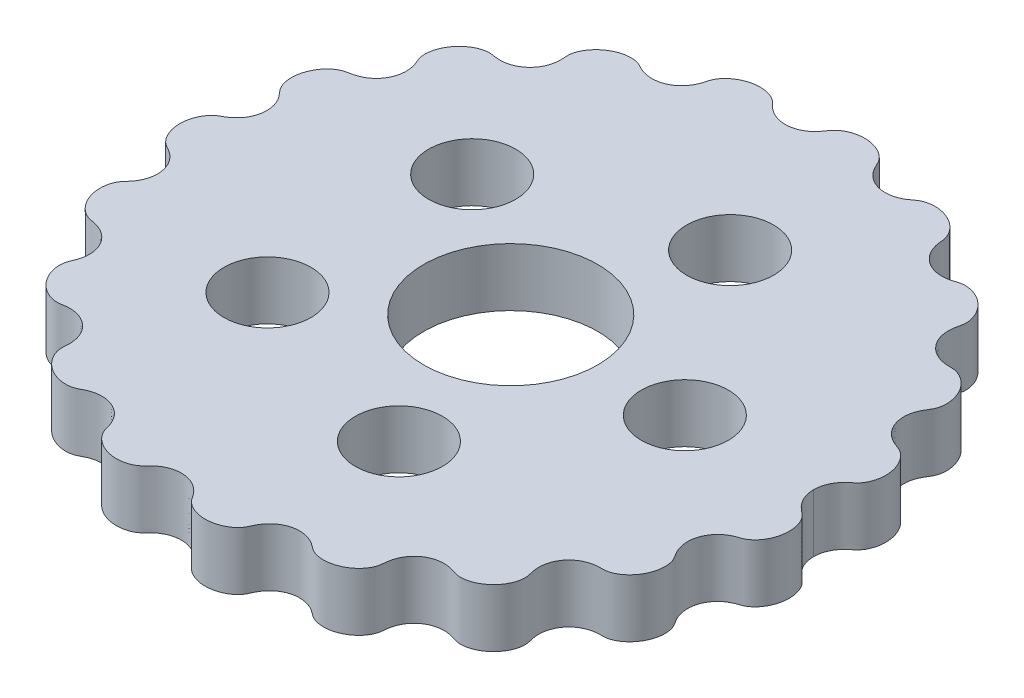
from build123d import *

# Parameters (mm, degrees)
BOSS_EXTRUDE1_START = 0.5
SKETCH1_R           = 7.5
SKETCH1_R_2         = 3.75
BOSS_EXTRUDE1_DEPTH = 5


with BuildPart() as part:
    # Sketch1 → Boss-Extrude1 (new body)
    with BuildSketch(Plane(origin=(0, 0, 0), x_dir=(1, 0, 0), z_dir=(0, 1, 0)).offset(BOSS_EXTRUDE1_START)):
        with BuildLine():
            add(Edge.make_bspline(
                [(26.100000001, 0), (26.100000001, -0.037654823), (26.101959838, -0.112657778), (26.110778914, -0.269126865), (26.134236474, -0.431457932), (26.169271902, -0.604227737), (26.215706935, -0.771665888), (26.2732951, -0.936077152), (26.341753555, -1.096140667), (26.427915849, -1.265624131), (26.534785055, -1.441856171), (26.699683699, -1.67031679), (26.901439537, -1.88987584), (27.124804262, -2.086960491), (27.362808408, -2.265185488), (27.541686596, -2.422902757), (27.696832367, -2.612532966), (27.831038284, -2.823925745), (27.942707414, -3.055157968), (28.032027129, -3.302051278), (28.11328707, -3.620150325), (28.164200717, -4.011385863), (28.158229712, -4.465911271), (28.068723695, -4.971978987), (27.92239684, -5.391891507), (27.752179238, -5.726439419), (27.579155333, -5.986088777), (27.422588116, -6.181127718), (27.208663225, -6.396612626), (26.970426874, -6.581500429), (26.704262294, -6.714420074), (26.426139512, -6.802056051), (26.208386955, -6.88526241), (25.996005014, -6.981754411), (25.792352168, -7.095680473), (25.506454674, -7.288419365), (25.166810016, -7.595932091), (24.823327667, -8.065640834), (24.573113299, -8.72284226), (24.513192387, -9.374110704), (24.595878356, -9.908866564), (24.732910005, -10.306165942), (24.863450157, -10.578322252), (24.983619743, -10.787813544), (25.118076956, -10.987994036), (25.243899655, -11.194436481), (25.335973849, -11.425133948), (25.399465388, -11.670686177), (25.434320143, -11.928228008), (25.441972483, -12.193681648), (25.418791023, -12.524941115), (25.342360013, -12.916594687), (25.191232071, -13.347764303), (24.944934542, -13.798710217), (24.636097611, -14.197365909), (24.319379046, -14.49299579), (24.014552178, -14.704170688), (23.744181638, -14.844097629), (23.521984724, -14.930759504), (23.295178334, -14.990896749), (23.066212193, -15.018050457), (22.836177534, -15.015427607), (22.60645362, -15.01876633), (22.377139997, -15.037432831), (22.149964766, -15.073477643), (21.901722715, -15.134262004), (21.63640528, -15.227464361), (21.285248205, -15.397408544), (20.867012031, -15.696199645), (20.457707614, -16.15442787), (20.167634198, -16.744097483), (20.040652676, -17.344074218), (20.044251146, -17.837567352), (20.101291606, -18.208300972), (20.178290253, -18.510160997), (20.237387066, -18.752911084), (20.254165851, -19.007094175), (20.236737197, -19.264546648), (20.175345509, -19.587685891), (20.045401481, -19.966212229), (19.825733649, -20.379092954), (19.503349148, -20.792215121), (19.125691798, -21.140607349), (18.706122195, -21.419205006), (18.312603135, -21.597813456), (17.95729147, -21.7007495), (17.659059083, -21.747208145), (17.425046357, -21.759337106), (17.196962801, -21.74598206), (16.978070969, -21.704489959), (16.767542661, -21.633081261), (16.557577444, -21.561231407), (16.343192492, -21.502693833), (16.125264662, -21.459296016), (15.796467785, -21.420434357), (15.354937396, -21.427964236), (14.788969176, -21.550301969), (14.15455542, -21.88057341), (13.666183716, -22.345893253), (13.336362649, -22.88226304), (13.173492136, -23.353715627), (13.104616128, -23.716957195), (13.076673275, -24.02279806), (13.057814189, -24.268242303), (12.998712206, -24.514111874), (12.903235055, -24.754151925), (12.744151813, -25.045309117), (12.499019901, -25.369043134), (12.15565715, -25.696338346), (11.704870213, -25.994619846), (11.211604108, -26.212225806), (10.68997676, -26.343697667), (10.221282682, -26.37756552), (9.820613034, -26.342575186), (9.498973158, -26.26665957), (9.255580912, -26.177092448), (9.029799659, -26.05655854), (8.831572762, -25.902571784), (8.58391576, -25.71111477), (8.264466121, -25.51104552), (7.810081456, -25.312340621), (7.205513819, -25.192791232), (6.550224923, -25.228730885), (5.971337018, -25.424349477), (5.536862389, -25.687803773), (5.245653307, -25.938729612), (5.05538626, -26.143844122), (4.899938262, -26.348212338), (4.774598738, -26.545523005), (4.66455004, -26.751857795), (4.569043476, -26.964881996), (4.476314366, -27.179586841), (4.353499791, -27.379281189), (4.203299856, -27.561863118), (4.032131291, -27.727950003), (3.79525899, -27.914521158), (3.482483914, -28.102825699), (3.089596665, -28.268830385), (2.604961188, -28.388334129), (2.095437226, -28.431200093), (1.573536083, -28.390048007), (1.119470453, -28.272805038), (0.751616161, -28.112409401), (0.4727867, -27.939857046), (0.273494126, -27.780889901), (0.100220004, -27.601224467), (-0.036900457, -27.400701128), (-0.167623208, -27.196704665), (-0.313051844, -27.002366981), (-0.512485215, -26.773835259), (-0.825221581, -26.489940267), (-1.286824513, -26.202366803), (-1.90652456, -26.003420899), (-2.599411552, -25.975353149), (-3.156761696, -26.100953574), (-3.565273796, -26.283242121), (-3.853430429, -26.463789354), (-4.040862241, -26.604608953), (-4.216144571, -26.760241463), (-4.380398314, -26.92724911), (-4.535647831, -27.102695562), (-4.7080389, -27.262129389), (-4.906562373, -27.395532872), (-5.122340191, -27.506639083), (-5.353111081, -27.594765527), (-5.595122062, -27.660809079), (-5.904112164, -27.714960075), (-6.280362612, -27.736643211), (-6.724192807, -27.701413515), (-7.222479814, -27.579956195), (-7.639241178, -27.403463388), (-7.974539319, -27.20159547), (-8.231562236, -27.001455404), (-8.420763279, -26.822438839), (-8.588375146, -26.628010193), (-8.729951421, -26.419225267), (-8.843841455, -26.197883212), (-8.918149441, -25.965106023), (-8.973095057, -25.727696563), (-9.043925473, -25.494305036), (-9.153099618, -25.209622768), (-9.306801805, -24.915867583), (-9.513499075, -24.623747571), (-9.839816184, -24.284860522), (-10.264400599, -23.977825959), (-10.829665695, -23.73805203), (-11.410498796, -23.660908882), (-11.876291721, -23.69638221), (-12.218754959, -23.773476834), (-12.444677349, -23.84513133), (-12.663781479, -23.935334112), (-12.876076728, -24.040286172), (-13.082031425, -24.157155246), (-13.298581127, -24.254322867), (-13.533913594, -24.317810826), (-13.780466914, -24.35378875), (-14.035834908, -24.361637388), (-14.296405869, -24.343065665), (-14.618522572, -24.288656576), (-14.994949776, -24.177456101), (-15.408578969, -23.98833338), (-15.837205257, -23.700628449), (-16.16490731, -23.393911293), (-16.404344734, -23.097848292), (-16.573318675, -22.829755719), (-16.687662049, -22.603571121), (-16.776686852, -22.372337621), (-16.837746076, -22.138542446), (-16.870186158, -21.9045043), (-16.866368416, -21.674536104), (-16.843233105, -21.446228653), (-16.832615307, -21.216921003), (-16.837266827, -20.987328792), (-16.860312682, -20.758768834), (-16.923293404, -20.419212422), (-17.071833991, -19.980587652), (-17.369040524, -19.477210915), (-17.874882375, -18.988476541), (-18.447970132, -18.67719025), (-19.027548133, -18.525710765), (-19.510111737, -18.503831617), (-19.876648139, -18.538267665), (-20.177623885, -18.593432706), (-20.42137194, -18.622411671), (-20.671244853, -18.609095567), (-20.920859774, -18.564988583), (-21.167935078, -18.490627654), (-21.4095885, -18.389962143), (-21.698210119, -18.235368531), (-22.02014446, -18.009296139), (-22.350982926, -17.698329853), (-22.663749807, -17.29065213), (-22.904833826, -16.843369276), (-23.047778376, -16.427343965), (-23.116267898, -16.057121475), (-23.13204139, -15.75076918), (-23.118687314, -15.513701439), (-23.079662445, -15.285779121), (-23.010740762, -15.071995011), (-22.917965638, -14.867945737), (-22.831783511, -14.661241535), (-22.759010837, -14.449176582), (-22.702274861, -14.232285466), (-22.657962991, -13.982307736), (-22.635886805, -13.699380389), (-22.650675118, -13.300053937), (-22.761871082, -12.783822482), (-23.029318636, -12.21492364), (-23.467562019, -11.712001704), (-23.923403017, -11.398122255), (-24.315464063, -11.222988994), (-24.609412241, -11.131419108), (-24.849484665, -11.076013531), (-25.092573068, -11.038656205), (-25.334505587, -10.990769991), (-25.569274268, -10.900544213), (-25.793687583, -10.779741828), (-26.005954771, -10.630692764), (-26.204437625, -10.457777096), (-26.430332209, -10.218351564), (-26.664824108, -9.899800806), (-26.878975385, -9.499593675), (-27.044436205, -9.01574461), (-27.129961923, -8.520121003), (-27.134474175, -8.0871314), (-27.084857153, -7.719810764), (-27.006013082, -7.425910719), (-26.920443462, -7.203342298), (-26.812236106, -6.99521479), (-26.678616217, -6.807274427), (-26.521312284, -6.639361313), (-26.367637466, -6.468593342), (-26.225484225, -6.287683037), (-26.097389186, -6.096643611), (-25.974680444, -5.876177314), (-25.864713462, -5.624531597), (-25.752433681, -5.264729725), (-25.681810261, -4.762581394), (-25.73099742, -4.146949182), (-25.961949285, -3.524047609), (-26.321265325, -3.010597952), (-26.690239717, -2.672986455), (-27.000992367, -2.462677557), (-27.274877294, -2.314024503), (-27.49416336, -2.194208061), (-27.693761752, -2.035785351), (-27.872384261, -1.849426066), (-28.029881682, -1.639477669), (-28.165833208, -1.41056993), (-28.278417606, -1.169112764), (-28.356850628, -0.949924532), (-28.409926509, -0.757383066), (-28.444786226, -0.594531067), (-28.467072671, -0.464613598), (-28.483773852, -0.334062838), (-28.494901549, -0.194206271), (-28.499073007, -0.086237954), (-28.499999999, -0.028769446), (-28.499999999, 0)],
                knots=[0.065357727, 0.065357727, 0.065357727, 0.065357727, 0.065357727, 0.066838802, 0.068319877, 0.069800952, 0.071282027, 0.072763102, 0.074244177, 0.075725252, 0.077206327, 0.079230954, 0.081255581, 0.085304836, 0.087329463, 0.08935409, 0.091378717, 0.093403344, 0.095635344, 0.097867345, 0.100099346, 0.102331347, 0.106795348, 0.11125935, 0.115505731, 0.119752112, 0.121875303, 0.123998494, 0.126121685, 0.128244875, 0.132212277, 0.134195978, 0.136179679, 0.13816338, 0.140147081, 0.142130782, 0.144114483, 0.149889299, 0.155664115, 0.161716618, 0.167769121, 0.171875721, 0.17392902, 0.17598232, 0.17803562, 0.18008892, 0.182142219, 0.184195519, 0.186452911, 0.188710303, 0.190967695, 0.193225087, 0.197739871, 0.202254655, 0.206449673, 0.210644692, 0.21483971, 0.216937219, 0.219034728, 0.220990732, 0.222946736, 0.22490274, 0.226858744, 0.228814748, 0.230770752, 0.232726756, 0.23468276, 0.237505487, 0.240328214, 0.245973668, 0.25207373, 0.258173791, 0.262418319, 0.266662848, 0.268785112, 0.270907376, 0.27302964, 0.275151904, 0.277414155, 0.279676405, 0.284200907, 0.288725408, 0.29324991, 0.297434601, 0.301619291, 0.305803982, 0.307896327, 0.309988673, 0.311878349, 0.313768025, 0.315657701, 0.317547377, 0.319437053, 0.32132673, 0.323216406, 0.325106082, 0.330697764, 0.336289446, 0.3427217, 0.349153953, 0.353337838, 0.357521724, 0.359613666, 0.361705609, 0.363797552, 0.365889495, 0.368183967, 0.37047844, 0.375067386, 0.379656332, 0.384245278, 0.388791482, 0.393337686, 0.39788389, 0.400156991, 0.402430093, 0.404562559, 0.406695025, 0.408827491, 0.410959957, 0.415224889, 0.419489821, 0.425619329, 0.431748836, 0.43728204, 0.440048642, 0.442815244, 0.444803142, 0.446791041, 0.44877894, 0.450766838, 0.452754737, 0.454742636, 0.456730534, 0.458718433, 0.460783687, 0.462848941, 0.466979449, 0.471109956, 0.475240464, 0.479777245, 0.484314026, 0.488850807, 0.491119197, 0.493387587, 0.495450918, 0.497514249, 0.499577579, 0.50164091, 0.503704241, 0.505767572, 0.509894233, 0.515977148, 0.522060063, 0.527644163, 0.533228263, 0.535221378, 0.537214493, 0.539207608, 0.541200724, 0.543193839, 0.545186954, 0.54718007, 0.549173185, 0.551305995, 0.553438805, 0.555571614, 0.557704424, 0.561970044, 0.566235664, 0.570664673, 0.575093682, 0.577308187, 0.579522691, 0.581737196, 0.583951701, 0.586025843, 0.588099985, 0.590174127, 0.592248269, 0.594322411, 0.596396553, 0.600544837, 0.603500405, 0.606455973, 0.612367108, 0.61826056, 0.624154012, 0.626168793, 0.628183573, 0.630198354, 0.632213134, 0.634227915, 0.636242695, 0.638257476, 0.640272256, 0.642493095, 0.644713933, 0.646934771, 0.64915561, 0.653597287, 0.658038963, 0.662348161, 0.666657359, 0.668811958, 0.670966557, 0.673121156, 0.675275756, 0.677228627, 0.679181499, 0.681134371, 0.683087243, 0.685040114, 0.686992986, 0.688945858, 0.69089873, 0.696785964, 0.702673198, 0.708614477, 0.714555757, 0.718723943, 0.722892129, 0.724976222, 0.727060315, 0.729144408, 0.7312285, 0.733454223, 0.735679945, 0.737905667, 0.740131389, 0.744582833, 0.749034278, 0.753292913, 0.757551548, 0.761810184, 0.763939501, 0.766068819, 0.767975191, 0.769881564, 0.771787936, 0.773694308, 0.77560068, 0.777507052, 0.779413425, 0.781319797, 0.784235185, 0.787150573, 0.792981348, 0.799176944, 0.80537254, 0.809561259, 0.811655619, 0.813749979, 0.815844338, 0.817938698, 0.820033058, 0.822127418, 0.82436519, 0.826602962, 0.828840734, 0.831078507, 0.835554051, 0.840029596, 0.844222519, 0.848415442, 0.852608365, 0.854704826, 0.856801288, 0.858757317, 0.860713346, 0.862669375, 0.864625404, 0.866581433, 0.868537462, 0.870493491, 0.872449521, 0.875160805, 0.87787209, 0.883294658, 0.889615361, 0.895936064, 0.900181909, 0.904427753, 0.906550675, 0.908673598, 0.91079652, 0.912919442, 0.915182616, 0.91744579, 0.919708964, 0.921972138, 0.924235312, 0.925366899, 0.926498486, 0.927630073, 0.92876166, 0.929893247, 0.931024834, 0.931024834, 0.931024834, 0.931024834, 0.931024834], degree=4))
            add(Edge.make_bspline(
                [(26.100000001, 0), (26.100000001, 0.037557605), (26.101960172, 0.11236891), (26.11078076, 0.268515148), (26.134241319, 0.430312774), (26.169279567, 0.602699325), (26.215712536, 0.769655848), (26.273296838, 0.933610033), (26.34172375, 1.093214643), (26.427887255, 1.262171064), (26.534631095, 1.437956629), (26.66472128, 1.617457312), (26.820221458, 1.797178197), (26.990110154, 1.963295025), (27.170908295, 2.117246114), (27.359583137, 2.261393395), (27.534725755, 2.42249524), (27.68734562, 2.613319468), (27.819402466, 2.825437943), (27.929409737, 3.056775069), (28.017350198, 3.303529964), (28.097313972, 3.621173349), (28.14718039, 4.011594981), (28.14070842, 4.466301535), (28.050717292, 4.97349364), (27.882896183, 5.454979193), (27.671504475, 5.84304381), (27.44357466, 6.144857491), (27.22674656, 6.364817609), (27.040892978, 6.516562131), (26.843642223, 6.643249286), (26.635913668, 6.738215402), (26.419935905, 6.811078154), (26.206939903, 6.891943154), (25.999467089, 6.986584145), (25.799911288, 7.096971584), (25.514583784, 7.286926668), (25.171992168, 7.593045833), (24.825107804, 8.063163705), (24.5729884, 8.722990296), (24.513513946, 9.375105339), (24.596667178, 9.908457378), (24.733854448, 10.304635684), (24.864153794, 10.576176989), (24.983841337, 10.78526845), (25.116626146, 10.985976922), (25.23781854, 11.194548661), (25.326672131, 11.425792091), (25.387836907, 11.671325816), (25.420923383, 11.928463132), (25.427271397, 12.193315352), (25.402925967, 12.523691905), (25.325735566, 12.914209417), (25.174039331, 13.345327688), (24.926907331, 13.79725834), (24.616364755, 14.197845719), (24.29698117, 14.495520079), (23.989587623, 14.708050702), (23.718534776, 14.847912779), (23.497907731, 14.934027896), (23.274665325, 14.993741496), (23.051299597, 15.022739648), (22.826527034, 15.023767999), (22.602061074, 15.027768327), (22.378022274, 15.045955422), (22.15589886, 15.080417823), (21.828556405, 15.158511555), (21.409282012, 15.322259795), (20.924725716, 15.635210396), (20.456823885, 16.15782959), (20.166872697, 16.748469446), (20.041025765, 17.347126751), (20.045267093, 17.839438354), (20.102257891, 18.209228311), (20.177807446, 18.510727554), (20.231772918, 18.754068222), (20.244874723, 19.007789076), (20.225231154, 19.26440437), (20.174580684, 19.52116384), (20.09617018, 19.774796717), (19.967529458, 20.0808296), (19.769244222, 20.426950741), (19.48836858, 20.785956985), (19.112265891, 21.132969663), (18.695113942, 21.411025316), (18.304377275, 21.589914677), (17.951596369, 21.694385138), (17.597097582, 21.752232251), (17.302747889, 21.761285903), (17.01353957, 21.72416988), (16.741890871, 21.635235734), (16.525460698, 21.563366751), (16.30449365, 21.505143996), (16.079996624, 21.463086124), (15.830837481, 21.437177305), (15.558265867, 21.434810853), (15.186128323, 21.472203392), (14.696111953, 21.603682941), (14.145806733, 21.892344423), (13.663352315, 22.3528318), (13.335089923, 22.888301692), (13.173326778, 23.358816985), (13.10466991, 23.721205101), (13.075926055, 24.026250081), (13.052488399, 24.270732841), (12.989529913, 24.514981911), (12.892121578, 24.75348234), (12.73129963, 25.042745906), (12.48537644, 25.364486059), (12.14194144, 25.6899342), (11.690895191, 25.987555412), (11.196405878, 26.205372018), (10.672319964, 26.337289188), (10.200295403, 26.371119582), (9.79682711, 26.335572462), (9.474750205, 26.259329406), (9.232977676, 26.170565191), (9.009974637, 26.052913706), (8.813709595, 25.905471503), (8.570429252, 25.719531022), (8.258164128, 25.523707411), (7.809364316, 25.324975745), (7.207254198, 25.202018598), (6.546067121, 25.235297975), (5.877241902, 25.46217649), (5.398588959, 25.786008977), (5.084963573, 26.105496235), (4.885275351, 26.374184304), (4.766566725, 26.56369587), (4.661655149, 26.761176326), (4.569316509, 26.964531297), (4.477345935, 27.168404949), (4.359380537, 27.358962353), (4.214368301, 27.53730225), (4.04657292, 27.702735184), (3.809779019, 27.892470211), (3.492450279, 28.086181237), (3.093047806, 28.256870657), (2.602432058, 28.378851651), (2.089146834, 28.422578188), (1.565967934, 28.381961626), (1.112700174, 28.266239985), (0.745063975, 28.107841233), (0.465765003, 27.937570102), (0.265546245, 27.780769343), (0.090316159, 27.603947454), (-0.050614273, 27.406772328), (-0.182236215, 27.203960446), (-0.32748241, 27.01023592), (-0.526391485, 26.782147944), (-0.838010778, 26.498557331), (-1.298111394, 26.211094086), (-1.918402994, 26.011412018), (-2.614461149, 25.984022917), (-3.173523862, 26.112524982), (-3.581992111, 26.29793532), (-3.867307934, 26.479069847), (-4.049922769, 26.617384469), (-4.221152863, 26.769533189), (-4.381916757, 26.932432711), (-4.535916963, 27.101844858), (-4.706349347, 27.255419887), (-4.902143243, 27.386349656), (-5.116496624, 27.496610446), (-5.347239404, 27.585081759), (-5.591110656, 27.651879702), (-5.902424379, 27.706740788), (-6.281662868, 27.728850923), (-6.729961118, 27.693395981), (-7.234342379, 27.570243689), (-7.65633568, 27.39048211), (-7.996662398, 27.184271517), (-8.256329457, 26.979520574), (-8.448308601, 26.796657484), (-8.651059963, 26.555390104), (-8.81700112, 26.293818775), (-8.913447768, 26.03917149), (-8.970105978, 25.812426923), (-9.032713325, 25.587290319), (-9.125707716, 25.309967392), (-9.315929764, 24.909990901), (-9.674728567, 24.436130369), (-10.183459835, 24.025846061), (-10.836211591, 23.747068892), (-11.420435291, 23.669904101), (-11.88504253, 23.705810937), (-12.226667293, 23.78306041), (-12.452036547, 23.854757813), (-12.670772627, 23.944623883), (-12.882685423, 24.04910601), (-13.089636758, 24.163269032), (-13.307649025, 24.25586997), (-13.543038731, 24.316628715), (-13.789378657, 24.350416644), (-14.044170323, 24.356729239), (-14.304069866, 24.336979732), (-14.625232977, 24.28158743), (-15.000545755, 24.169770966), (-15.412965417, 23.980630522), (-15.840661536, 23.693607689), (-16.214284288, 23.344751587), (-16.484954149, 22.99257982), (-16.66924689, 22.660103051), (-16.782520625, 22.371064468), (-16.845505845, 22.138296706), (-16.880496111, 21.905251417), (-16.881316199, 21.675736003), (-16.860821291, 21.447623517), (-16.850555776, 21.218839449), (-16.85536403, 20.989715924), (-16.878196474, 20.761647471), (-16.940732923, 20.422799562), (-17.08843954, 19.985128723), (-17.385800937, 19.480651111), (-17.894498222, 18.990461329), (-18.469877881, 18.681086595), (-18.990372753, 18.548665966), (-19.406487185, 18.518804425), (-19.705993797, 18.531117789), (-19.944219194, 18.557992616), (-20.18020116, 18.599236489), (-20.419074353, 18.623629916), (-20.665189551, 18.609868387), (-20.913081212, 18.565696025), (-21.160188551, 18.49160002), (-21.403579002, 18.390348128), (-21.694263355, 18.234921695), (-22.018523547, 18.007449916), (-22.351791039, 17.694414257), (-22.666813538, 17.283805033), (-22.909544257, 16.833152952), (-23.05328345, 16.413896066), (-23.121977202, 16.040814849), (-23.137486808, 15.73333485), (-23.124191467, 15.496830586), (-23.085834476, 15.270705519), (-23.019759809, 15.05927003), (-22.930938393, 14.856805801), (-22.846986576, 14.652472592), (-22.775838439, 14.443088067), (-22.720106096, 14.229079512), (-22.661167611, 13.897241051), (-22.644448196, 13.442707496), (-22.741948127, 12.865327357), (-23.045635909, 12.219196868), (-23.44242448, 11.764680971), (-23.836324638, 11.475330273), (-24.161017984, 11.306249651), (-24.388411485, 11.212728737), (-24.623075892, 11.13984931), (-24.862494236, 11.084293925), (-25.104833104, 11.045464818), (-25.345143534, 10.99258107), (-25.578096715, 10.899626693), (-25.800907749, 10.777130542), (-26.011679105, 10.627076499), (-26.208845564, 10.453618678), (-26.433311014, 10.213944036), (-26.666458308, 9.895605218), (-26.879612895, 9.496087062), (-27.044681042, 9.013360245), (-27.130595173, 8.518940818), (-27.136149799, 8.086925061), (-27.088099036, 7.720199825), (-27.011063532, 7.426513435), (-26.927412142, 7.203721197), (-26.82146914, 6.995052925), (-26.691353099, 6.805240004), (-26.537235643, 6.635002809), (-26.384390326, 6.464109968), (-26.24276044, 6.283380129), (-26.114855808, 6.092759785), (-25.992262138, 5.872830791), (-25.882318571, 5.621822441), (-25.770018773, 5.262920474), (-25.698994495, 4.759665907), (-25.749262159, 4.140759284), (-25.98337725, 3.517989478), (-26.344967849, 3.008162522), (-26.711826659, 2.675630855), (-27.015956615, 2.470138443), (-27.283130804, 2.323166563), (-27.49569715, 2.20242773), (-27.691533018, 2.045315012), (-27.868698672, 1.860041494), (-28.02624223, 1.650179776), (-28.163215016, 1.419802986), (-28.276658401, 1.176817039), (-28.355709733, 0.956173448), (-28.409204863, 0.762425721), (-28.444342964, 0.598457074), (-28.466807893, 0.467595466), (-28.4836432, 0.336334559), (-28.494860457, 0.1958312), (-28.499065536, 0.086806089), (-28.499999999, 0.028958742), (-28.499999999, 0)],
                knots=[0.065428509, 0.065428509, 0.065428509, 0.065428509, 0.065428509, 0.066909165, 0.06838982, 0.069870476, 0.071351132, 0.072831787, 0.074312443, 0.075793099, 0.077273754, 0.079298617, 0.08132348, 0.083348342, 0.085373205, 0.087398068, 0.089422931, 0.091447793, 0.093472656, 0.095704556, 0.097936456, 0.100168356, 0.102400256, 0.106864056, 0.111327856, 0.11561548, 0.119903104, 0.124190727, 0.126334539, 0.128478351, 0.130421745, 0.13236514, 0.134308534, 0.136251928, 0.138195322, 0.140138717, 0.142082111, 0.144025505, 0.149879071, 0.155732636, 0.161783086, 0.167833536, 0.171940286, 0.17399366, 0.176047035, 0.17810041, 0.180153784, 0.182207159, 0.184260534, 0.186517645, 0.188774756, 0.191031868, 0.193288979, 0.197803202, 0.202317424, 0.206554339, 0.210791254, 0.215028169, 0.217146627, 0.219265085, 0.22118072, 0.223096355, 0.22501199, 0.226927625, 0.22884326, 0.230758895, 0.23267453, 0.234590165, 0.240315033, 0.246039902, 0.252137777, 0.258235653, 0.262479911, 0.266724169, 0.268846298, 0.270968427, 0.273090556, 0.275212686, 0.277474466, 0.279736246, 0.281998027, 0.284259807, 0.288783368, 0.293306929, 0.297478465, 0.30165, 0.305821535, 0.307907303, 0.309993071, 0.313886946, 0.315833883, 0.31778082, 0.319727758, 0.321674695, 0.323621633, 0.32556857, 0.328264738, 0.330960906, 0.336353242, 0.34278217, 0.349211099, 0.353394823, 0.357578547, 0.359670409, 0.361762271, 0.363854133, 0.365945995, 0.3682398, 0.370533604, 0.375121214, 0.379708823, 0.384296433, 0.388884931, 0.393473428, 0.398061926, 0.400356175, 0.402650424, 0.404740985, 0.406831546, 0.408922108, 0.411012669, 0.415193791, 0.419374914, 0.425582296, 0.431789679, 0.437483986, 0.443178293, 0.445084123, 0.446989952, 0.448895782, 0.450801611, 0.452707441, 0.45461327, 0.4565191, 0.458424929, 0.460532562, 0.462640195, 0.46685546, 0.471070725, 0.47528599, 0.479822206, 0.484358421, 0.488894637, 0.491162745, 0.493430852, 0.495494138, 0.497557424, 0.49962071, 0.501683995, 0.503747281, 0.505810567, 0.509937139, 0.516017911, 0.522098683, 0.52776142, 0.533424156, 0.535376276, 0.537328396, 0.539280516, 0.541232636, 0.543184755, 0.545136875, 0.547088995, 0.549041115, 0.551195406, 0.553349697, 0.555503988, 0.557658279, 0.561966861, 0.566275442, 0.57078566, 0.575295877, 0.577550985, 0.579806094, 0.582061202, 0.584316311, 0.588303705, 0.590297402, 0.591294251, 0.592291099, 0.596278494, 0.600265888, 0.606334723, 0.612403558, 0.6182954, 0.624187243, 0.626202375, 0.628217508, 0.63023264, 0.632247772, 0.634262905, 0.636278037, 0.638293169, 0.640308302, 0.642529051, 0.6447498, 0.64697055, 0.649191299, 0.653632797, 0.658074296, 0.66238357, 0.666692845, 0.67100212, 0.673156757, 0.675311394, 0.677264526, 0.679217658, 0.68117079, 0.683123922, 0.685077055, 0.687030187, 0.688983319, 0.690936451, 0.69682189, 0.702707329, 0.708727249, 0.714747169, 0.718834421, 0.720878047, 0.722921673, 0.724965299, 0.727008925, 0.729052551, 0.731096177, 0.733342138, 0.735588098, 0.737834058, 0.740080019, 0.744571939, 0.74906386, 0.753364202, 0.757664545, 0.761964887, 0.764115058, 0.766265229, 0.768149956, 0.770034683, 0.771919409, 0.773804136, 0.775688862, 0.777573589, 0.779458316, 0.781343042, 0.787178143, 0.793013244, 0.799206318, 0.805399393, 0.807493698, 0.809588002, 0.811682307, 0.813776612, 0.815870916, 0.817965221, 0.820059526, 0.82215383, 0.82439128, 0.826628731, 0.828866181, 0.831103631, 0.835578532, 0.840053432, 0.844246889, 0.848440346, 0.852633803, 0.854730531, 0.856827259, 0.858783839, 0.860740418, 0.862696998, 0.864653577, 0.866610157, 0.868566736, 0.870523316, 0.872479895, 0.875190971, 0.877902047, 0.883324198, 0.88972267, 0.896121142, 0.90028496, 0.904448778, 0.906530687, 0.908612596, 0.910694505, 0.912776414, 0.915059729, 0.917343045, 0.91962636, 0.921909675, 0.924192991, 0.925334648, 0.926476306, 0.927617964, 0.928759621, 0.929901279, 0.931042936, 0.931042936, 0.931042936, 0.931042936, 0.931042936], degree=4))
        make_face()
        Circle(SKETCH1_R, mode=Mode.SUBTRACT)
        with Locations((15, 0)):
            Circle(SKETCH1_R_2, mode=Mode.SUBTRACT)
        with Locations((4.635254916, -14.265847744)):
            Circle(SKETCH1_R_2, mode=Mode.SUBTRACT)
        with Locations((-12.135254916, -8.816778784)):
            Circle(SKETCH1_R_2, mode=Mode.SUBTRACT)
        with Locations((-12.135254916, 8.816778784)):
            Circle(SKETCH1_R_2, mode=Mode.SUBTRACT)
        with Locations((4.635254916, 14.265847744)):
            Circle(SKETCH1_R_2, mode=Mode.SUBTRACT)
    extrude(amount=BOSS_EXTRUDE1_DEPTH)


solid = part.part
